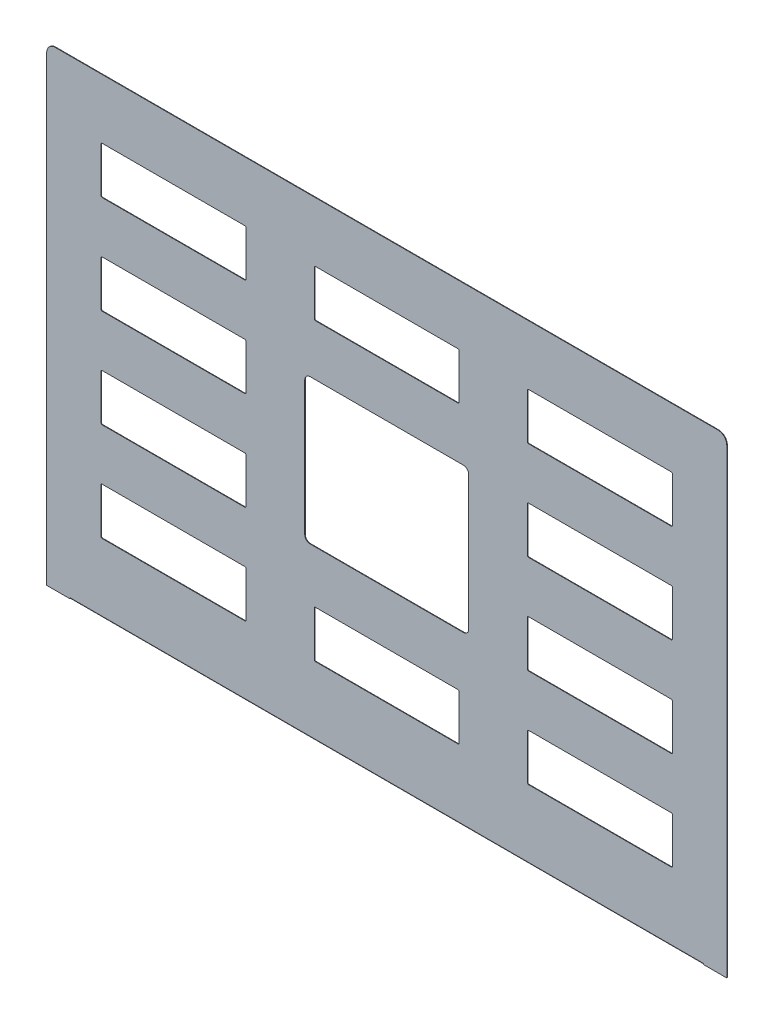
from build123d import *

# Parameters (mm, degrees)
BASE_FLANGE1_DEPTH            = 1
EDGE_FLANGE1_STRIP_W          = 6
EDGE_FLANGE1_STRIP_H          = 1
EDGE_FLANGE1_STRIP_CUT_DEPTH  = 1158
EDGE_FLANGE1_RELIEF_W         = 6.5
EDGE_FLANGE1_RELIEF_H         = 0.5
EDGE_FLANGE1_RELIEF_CUT_DEPTH = 1
EDGE_FLANGE1_DEPTH            = 1158
EDGE_FLANGE1_PROFILE_W        = 1158
EDGE_FLANGE1_PROFILE_H        = 17
EDGE_FLANGE1_PROFILE_R        = 2.75
EDGE_FLANGE1_FLAT_DEPTH       = 1
CUT_EXTRUDE1_DEPTH            = 10
CUT_EXTRUDE2_DEPTH            = 10


# Sheet-metal steps are written as plain solids
with BuildPart() as part:
    # Sketch1 → Base-Flange1 (new body)
    with BuildSketch(Plane.XY):
        with BuildLine():
            Line((0, 0), (1244, 0))
            Line((1244, 0), (1244, 844))
            ThreePointArc((1244, 844), (1239.313708499, 855.313708499), (1228, 860))
            Line((1228, 860), (16, 860))
            ThreePointArc((16, 860), (4.686291501, 855.313708499), (0, 844))
            Line((0, 844), (0, 0))
        make_face()
    extrude(amount=-BASE_FLANGE1_DEPTH)

    # Edge-Flange1 strip (across the edge) → Edge-Flange1 strip cut (cut)
    with BuildSketch(Plane(origin=(1201, 0, -1), x_dir=(0, 1, 0), z_dir=(-1, 0, 0))):
        with Locations((-1, -0.5)):
            Rectangle(EDGE_FLANGE1_STRIP_W, EDGE_FLANGE1_STRIP_H)
    extrude(amount=EDGE_FLANGE1_STRIP_CUT_DEPTH, mode=Mode.SUBTRACT)

    # Edge-Flange1 relief (on the sheet) → Edge-Flange1 relief cut (cut)
    with BuildSketch(Plane(origin=(1201, 2, -1), x_dir=(0, 1, 0), z_dir=(0, 0, -1))):
        with Locations((-2.75, 0.25)):
            Rectangle(EDGE_FLANGE1_RELIEF_W, EDGE_FLANGE1_RELIEF_H)
        with Locations((-2.75, -1158.25)):
            Rectangle(EDGE_FLANGE1_RELIEF_W, EDGE_FLANGE1_RELIEF_H)
    extrude(amount=-EDGE_FLANGE1_RELIEF_CUT_DEPTH, mode=Mode.SUBTRACT)

    # Edge-Flange1 bend section (across the edge) → Edge-Flange1 (add)
    with BuildSketch(Plane(origin=(1201, 0, -1), x_dir=(0, 1, 0), z_dir=(-1, 0, 0))):
        with BuildLine():
            Line((0, 1), (1, 1))
            ThreePointArc((1, 1), (1.292893219, 0.292893219), (2, 0))
            Line((2, 0), (2, -1))
            ThreePointArc((2, -1), (0.585786438, -0.414213562), (0, 1))
        make_face()
    extrude(amount=EDGE_FLANGE1_DEPTH)

    # Edge-Flange1 profile (on flange) → Edge-Flange1 flat (add)
    with BuildSketch(Plane(origin=(0, 0, -1), x_dir=(-1, 0, 0), z_dir=(0, -1, 0))):
        with Locations((-622, 9.5)):
            Rectangle(EDGE_FLANGE1_PROFILE_W, EDGE_FLANGE1_PROFILE_H)
        with Locations((-802, 9)):
            Circle(EDGE_FLANGE1_PROFILE_R, mode=Mode.SUBTRACT)
        with Locations((-982, 9)):
            Circle(EDGE_FLANGE1_PROFILE_R, mode=Mode.SUBTRACT)
        with Locations((-1162, 9)):
            Circle(EDGE_FLANGE1_PROFILE_R, mode=Mode.SUBTRACT)
        with Locations((-82, 9)):
            Circle(EDGE_FLANGE1_PROFILE_R, mode=Mode.SUBTRACT)
        with Locations((-262, 9)):
            Circle(EDGE_FLANGE1_PROFILE_R, mode=Mode.SUBTRACT)
        with Locations((-442, 9)):
            Circle(EDGE_FLANGE1_PROFILE_R, mode=Mode.SUBTRACT)
        with Locations((-622, 9)):
            Circle(EDGE_FLANGE1_PROFILE_R, mode=Mode.SUBTRACT)
    extrude(amount=-EDGE_FLANGE1_FLAT_DEPTH)

    # Sketch9 → Cut-Extrude1 (cut)
    with BuildSketch(Plane.XY):
        with BuildLine():
            Line((1142.5, 751), (881.5, 751))
            ThreePointArc((881.5, 751), (880.085786438, 750.414213562), (879.5, 749))
            Line((879.5, 749), (879.5, 667))
            ThreePointArc((879.5, 667), (880.085786438, 665.585786438), (881.5, 665))
            Line((881.5, 665), (1142.5, 665))
            ThreePointArc((1142.5, 665), (1143.914213562, 665.585786438), (1144.5, 667))
            Line((1144.5, 667), (1144.5, 749))
            ThreePointArc((1144.5, 749), (1143.914213562, 750.414213562), (1142.5, 751))
        make_face()
        with BuildLine():
            Line((754.5, 749), (754.5, 667))
            ThreePointArc((754.5, 667), (753.914213562, 665.585786438), (752.5, 665))
            Line((752.5, 665), (491.5, 665))
            ThreePointArc((491.5, 665), (490.085786438, 665.585786438), (489.5, 667))
            Line((489.5, 667), (489.5, 749))
            ThreePointArc((489.5, 749), (490.085786438, 750.414213562), (491.5, 751))
            Line((491.5, 751), (752.5, 751))
            ThreePointArc((752.5, 751), (753.914213562, 750.414213562), (754.5, 749))
        make_face()
        with BuildLine():
            Line((364.5, 749), (364.5, 667))
            ThreePointArc((364.5, 667), (363.914213562, 665.585786438), (362.5, 665))
            Line((362.5, 665), (101.5, 665))
            ThreePointArc((101.5, 665), (100.085786438, 665.585786438), (99.5, 667))
            Line((99.5, 667), (99.5, 749))
            ThreePointArc((99.5, 749), (100.085786438, 750.414213562), (101.5, 751))
            Line((101.5, 751), (362.5, 751))
            ThreePointArc((362.5, 751), (363.914213562, 750.414213562), (364.5, 749))
        make_face()
        with BuildLine():
            Line((364.5, 569), (364.5, 487))
            ThreePointArc((364.5, 487), (363.914213562, 485.585786438), (362.5, 485))
            Line((362.5, 485), (101.5, 485))
            ThreePointArc((101.5, 485), (100.085786438, 485.585786438), (99.5, 487))
            Line((99.5, 487), (99.5, 569))
            ThreePointArc((99.5, 569), (100.085786438, 570.414213562), (101.5, 571))
            Line((101.5, 571), (362.5, 571))
            ThreePointArc((362.5, 571), (363.914213562, 570.414213562), (364.5, 569))
        make_face()
        with BuildLine():
            Line((364.5, 389), (364.5, 307))
            ThreePointArc((364.5, 307), (363.914213562, 305.585786438), (362.5, 305))
            Line((362.5, 305), (101.5, 305))
            ThreePointArc((101.5, 305), (100.085786438, 305.585786438), (99.5, 307))
            Line((99.5, 307), (99.5, 389))
            ThreePointArc((99.5, 389), (100.085786438, 390.414213562), (101.5, 391))
            Line((101.5, 391), (362.5, 391))
            ThreePointArc((362.5, 391), (363.914213562, 390.414213562), (364.5, 389))
        make_face()
        with BuildLine():
            Line((754.5, 209), (754.5, 127))
            ThreePointArc((754.5, 127), (753.914213562, 125.585786438), (752.5, 125))
            Line((752.5, 125), (491.5, 125))
            ThreePointArc((491.5, 125), (490.085786438, 125.585786438), (489.5, 127))
            Line((489.5, 127), (489.5, 209))
            ThreePointArc((489.5, 209), (490.085786438, 210.414213562), (491.5, 211))
            Line((491.5, 211), (752.5, 211))
            ThreePointArc((752.5, 211), (753.914213562, 210.414213562), (754.5, 209))
        make_face()
        with BuildLine():
            Line((364.5, 209), (364.5, 127))
            ThreePointArc((364.5, 127), (363.914213562, 125.585786438), (362.5, 125))
            Line((362.5, 125), (101.5, 125))
            ThreePointArc((101.5, 125), (100.085786438, 125.585786438), (99.5, 127))
            Line((99.5, 127), (99.5, 209))
            ThreePointArc((99.5, 209), (100.085786438, 210.414213562), (101.5, 211))
            Line((101.5, 211), (362.5, 211))
            ThreePointArc((362.5, 211), (363.914213562, 210.414213562), (364.5, 209))
        make_face()
        with BuildLine():
            Line((1144.5, 569), (1144.5, 487))
            ThreePointArc((1144.5, 487), (1143.914213562, 485.585786438), (1142.5, 485))
            Line((1142.5, 485), (881.5, 485))
            ThreePointArc((881.5, 485), (880.085786438, 485.585786438), (879.5, 487))
            Line((879.5, 487), (879.5, 569))
            ThreePointArc((879.5, 569), (880.085786438, 570.414213562), (881.5, 571))
            Line((881.5, 571), (1142.5, 571))
            ThreePointArc((1142.5, 571), (1143.914213562, 570.414213562), (1144.5, 569))
        make_face()
        with BuildLine():
            Line((1144.5, 389), (1144.5, 307))
            ThreePointArc((1144.5, 307), (1143.914213562, 305.585786438), (1142.5, 305))
            Line((1142.5, 305), (881.5, 305))
            ThreePointArc((881.5, 305), (880.085786438, 305.585786438), (879.5, 307))
            Line((879.5, 307), (879.5, 389))
            ThreePointArc((879.5, 389), (880.085786438, 390.414213562), (881.5, 391))
            Line((881.5, 391), (1142.5, 391))
            ThreePointArc((1142.5, 391), (1143.914213562, 390.414213562), (1144.5, 389))
        make_face()
        with BuildLine():
            Line((1144.5, 209), (1144.5, 127))
            ThreePointArc((1144.5, 127), (1143.914213562, 125.585786438), (1142.5, 125))
            Line((1142.5, 125), (881.5, 125))
            ThreePointArc((881.5, 125), (880.085786438, 125.585786438), (879.5, 127))
            Line((879.5, 127), (879.5, 209))
            ThreePointArc((879.5, 209), (880.085786438, 210.414213562), (881.5, 211))
            Line((881.5, 211), (1142.5, 211))
            ThreePointArc((1142.5, 211), (1143.914213562, 210.414213562), (1144.5, 209))
        make_face()
    extrude(amount=-CUT_EXTRUDE1_DEPTH, mode=Mode.SUBTRACT)

    # Sketch10 → Cut-Extrude2 (cut)
    with BuildSketch(Plane.XY):
        with BuildLine():
            Line((482, 306.5), (762, 306.5))
            ThreePointArc((762, 306.5), (769.071067812, 309.428932188), (772, 316.5))
            Line((772, 316.5), (772, 561.5))
            ThreePointArc((772, 561.5), (769.071067812, 568.571067812), (762, 571.5))
            Line((762, 571.5), (482, 571.5))
            ThreePointArc((482, 571.5), (474.928932188, 568.571067812), (472, 561.5))
            Line((472, 561.5), (472, 316.5))
            ThreePointArc((472, 316.5), (474.928932188, 309.428932188), (482, 306.5))
        make_face()
    extrude(amount=-CUT_EXTRUDE2_DEPTH, mode=Mode.SUBTRACT)


solid = part.part
